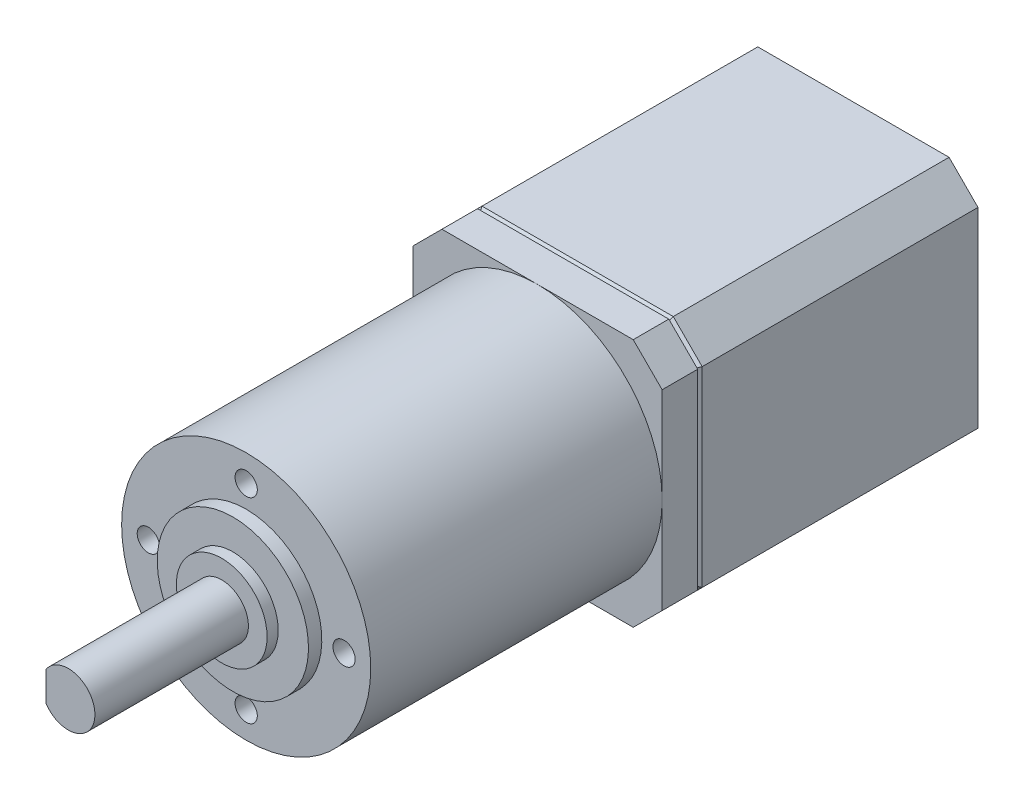
from build123d import *

# Parameters (mm, degrees)
BOSS_EXTRUDE1_DEPTH            = 31.5
BOSS_EXTRUDE2_DEPTH            = 4
CHAMFER1_SIZE                  = 0.5
M3X0_5_TAPPED_HOLE1_AT_2_COUNT = 2
M3X0_5_TAPPED_HOLE1_AT_2_PITCH = 15.556349186
M3X0_5_TAPPED_HOLE1_AT_3_COUNT = 2
M3X0_5_TAPPED_HOLE1_AT_3_PITCH = 22
M3X0_5_TAPPED_HOLE1_AT_4_COUNT = 2
M3X0_5_TAPPED_HOLE1_AT_4_PITCH = 15.556349186
SKETCH8_R                      = 5.1
SKETCH8_R_2                    = 3
BOSS_EXTRUDE3_DEPTH            = 1.25
CUT_EXTRUDE1_DEPTH             = 15


with BuildPart() as part:
    # Sketch1 → Boss-Extrude1 (new body)
    with BuildSketch(Plane.XY):
        Polygon((10.75, -14), (-10.75, -14), (-14, -10.75), (-14, 10.75), (-10.75, 14), (10.75, 14), (14, 10.75), (14, -10.75), align=None)
    extrude(amount=BOSS_EXTRUDE1_DEPTH)

    # Chamfer1
    chamfer1_edges = [part.edges().sort_by_distance(p)[0] for p in [
        (0, 14, 31.5),
        (-12.375, 12.375, 31.5),
        (-14, 0, 31.5),
        (-12.375, -12.375, 31.5),
        (0, -14, 31.5),
        (12.375, -12.375, 31.5),
        (14, 0, 31.5),
        (12.375, 12.375, 31.5),
    ]]
    chamfer(chamfer1_edges, length=CHAMFER1_SIZE)


with BuildPart() as body_2:
    # Sketch3 → Boss-Extrude2 (new body)
    with BuildSketch(Plane.XY.offset(31.5)):
        Polygon((14, 10.75), (10.75, 14), (-10.75, 14), (-14, 10.75), (-14, -10.75), (-10.75, -14), (10.75, -14), (14, -10.75), align=None)
    extrude(amount=BOSS_EXTRUDE2_DEPTH)

    # Sketch4 → Revolve1 (revolve)
    with BuildSketch(Plane(origin=(0, 0, 0), x_dir=(0, 0, -1), z_dir=(1, 0, 0))):
        Polygon((-88.25, 0), (-88.25, 3), (-69.75, 3), (-69.75, 8.5), (-68.25, 8.5), (-68.25, 14), (-35.5, 14), (-35.5, 0), align=None)
    revolve(axis=Axis((0, 0, 35.5), (0, 0, 1)))

    # Sketch7 → M3x0.5 Tapped Hole1 (revolve, cut)
    with BuildSketch(Plane(origin=(0, 11, 68.25), x_dir=(0, -1, 0), z_dir=(1, 0, 0))):
        Polygon((0, 0), (0, 5.751075774), (1.25, 5), (1.25, 0), align=None)
    m3x0_5_tapped_hole1 = revolve(axis=Axis((0, 11, 74.6), (0, 0, -1)), mode=Mode.SUBTRACT)

    # M3x0.5 Tapped Hole1 at 2: M3x0.5 Tapped Hole1 ×2
    with Locations(*[Vector(0.7071067811865472, -0.7071067811865478, 0) * (i * M3X0_5_TAPPED_HOLE1_AT_2_PITCH) for i in range(1, M3X0_5_TAPPED_HOLE1_AT_2_COUNT)]):
        add(m3x0_5_tapped_hole1, mode=Mode.SUBTRACT)

    # M3x0.5 Tapped Hole1 at 3: M3x0.5 Tapped Hole1 ×2
    with Locations(*[(0, -i * M3X0_5_TAPPED_HOLE1_AT_3_PITCH, 0) for i in range(1, M3X0_5_TAPPED_HOLE1_AT_3_COUNT)]):
        add(m3x0_5_tapped_hole1, mode=Mode.SUBTRACT)

    # M3x0.5 Tapped Hole1 at 4: M3x0.5 Tapped Hole1 ×2
    with Locations(*[Vector(-0.7071067811865472, -0.7071067811865478, 0) * (i * M3X0_5_TAPPED_HOLE1_AT_4_PITCH) for i in range(1, M3X0_5_TAPPED_HOLE1_AT_4_COUNT)]):
        add(m3x0_5_tapped_hole1, mode=Mode.SUBTRACT)

    # Sketch8 → Boss-Extrude3 (add)
    with BuildSketch(Plane.XY.offset(69.75)):
        Circle(SKETCH8_R)
        Circle(SKETCH8_R_2, mode=Mode.SUBTRACT)
    extrude(amount=BOSS_EXTRUDE3_DEPTH)

    # Sketch9 → Cut-Extrude1 (cut)
    with BuildSketch(Plane.XY.offset(88.25)):
        with BuildLine():
            Line((-2.5, 1.658312395), (-2.5, -1.658312395))
            ThreePointArc((-2.5, -1.658312395), (-3, 0), (-2.5, 1.658312395))
        make_face()
    extrude(amount=-CUT_EXTRUDE1_DEPTH, mode=Mode.SUBTRACT)


solid = Compound([part.part, body_2.part])
